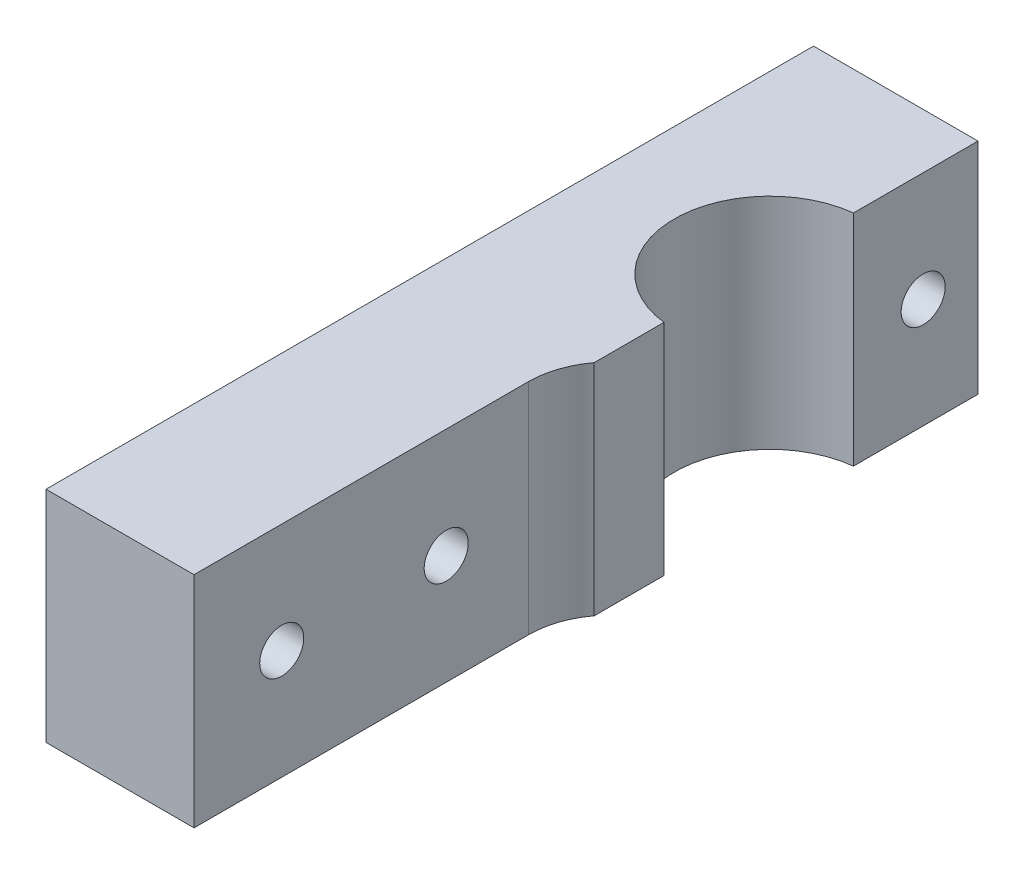
from build123d import *

# Parameters (mm, degrees)
BOSS_EXTRUDE1_DEPTH                                 = 12.7
CBORE_FOR_10_BINDING_HEAD_MACHINE_SCREW_D           = 5.1054
CBORE_FOR_10_BINDING_HEAD_MACHINE_SCREW_DEPTH       = 508
CBORE_FOR_10_BINDING_HEAD_MACHINE_SCREW_CBORE_D     = 11.1125
CBORE_FOR_10_BINDING_HEAD_MACHINE_SCREW_CBORE_DEPTH = 3.1242
CBORE_FOR_10_BINDING_HEAD_MACHINE_SCREW_TIP         = 1.533816902
SKETCH7_W                                           = 1.905
SKETCH7_H                                           = 44.45
CUT_EXTRUDE1_DEPTH                                  = 72.346425278
FILLET1_R                                           = 9.525


with BuildPart() as part:
    # Sketch1 → Boss-Extrude1 (new, symmetric)
    with BuildSketch(Plane(origin=(0, 0, 0), x_dir=(1, 0, 0), z_dir=(0, 1, 0))):
        with BuildLine():
            Line((-1.27, 10.975768811), (-1.27, 25.4))
            Line((-1.27, 25.4), (-20.32, 25.4))
            Line((-20.32, 25.4), (-20.32, -63.5))
            Line((-20.32, -63.5), (-1.27, -63.5))
            Line((-1.27, -63.5), (-1.27, -10.975768811))
            ThreePointArc((-1.27, -10.975768811), (-11.049, 0), (-1.27, 10.975768811))
        make_face()
    extrude(amount=BOSS_EXTRUDE1_DEPTH, both=True)

    # CBORE for #10 Binding Head Machine Screw1
    with Locations(Plane.ZY.offset(20.32)):
        with Locations((-19.05, 0), (34.29, 0), (53.34, 0)):
            CounterBoreHole(CBORE_FOR_10_BINDING_HEAD_MACHINE_SCREW_D / 2, CBORE_FOR_10_BINDING_HEAD_MACHINE_SCREW_CBORE_D / 2, CBORE_FOR_10_BINDING_HEAD_MACHINE_SCREW_CBORE_DEPTH, depth=CBORE_FOR_10_BINDING_HEAD_MACHINE_SCREW_DEPTH)
            with Locations((0, 0, -(CBORE_FOR_10_BINDING_HEAD_MACHINE_SCREW_DEPTH + CBORE_FOR_10_BINDING_HEAD_MACHINE_SCREW_TIP / 2))):  # 118° drill point
                Cone(0, CBORE_FOR_10_BINDING_HEAD_MACHINE_SCREW_D / 2, CBORE_FOR_10_BINDING_HEAD_MACHINE_SCREW_TIP, mode=Mode.SUBTRACT)

    # Sketch7 → Cut-Extrude1 (cut, through all)
    with BuildSketch(Plane(origin=(0, 12.7, 0), x_dir=(1, 0, 0), z_dir=(0, 1, 0))):
        with Locations((-2.2225, -41.275)):
            Rectangle(SKETCH7_W, SKETCH7_H)
    extrude(amount=-CUT_EXTRUDE1_DEPTH, mode=Mode.SUBTRACT)

    # Fillet1
    # the kernel refuses this fillet: 9.525 mm, written as the material it adds along each edge
    with BuildSketch(Plane(origin=(-3.175, 12.7, 19.05), x_dir=(1, 0, 0), z_dir=(0, -1, 0))) as fillet1_piece_1:
        with BuildLine():
            CenterArc((9.525, 5.715), FILLET1_R, 180, 36.869897646)
            Line((0, 5.715), (-0.1905, 5.715))
            Line((-0.1905, 5.715), (-0.1905, 0))
            Line((-0.1905, 0), (0, -0.1905))
            ThreePointArc((0, -0.1905), (0.9525, -0.1905), (1.7526, -0.1143))
            Line((1.7526, -0.1143), (1.905, 0))
        make_face()
    extrude(amount=25.4)


solid = part.part
